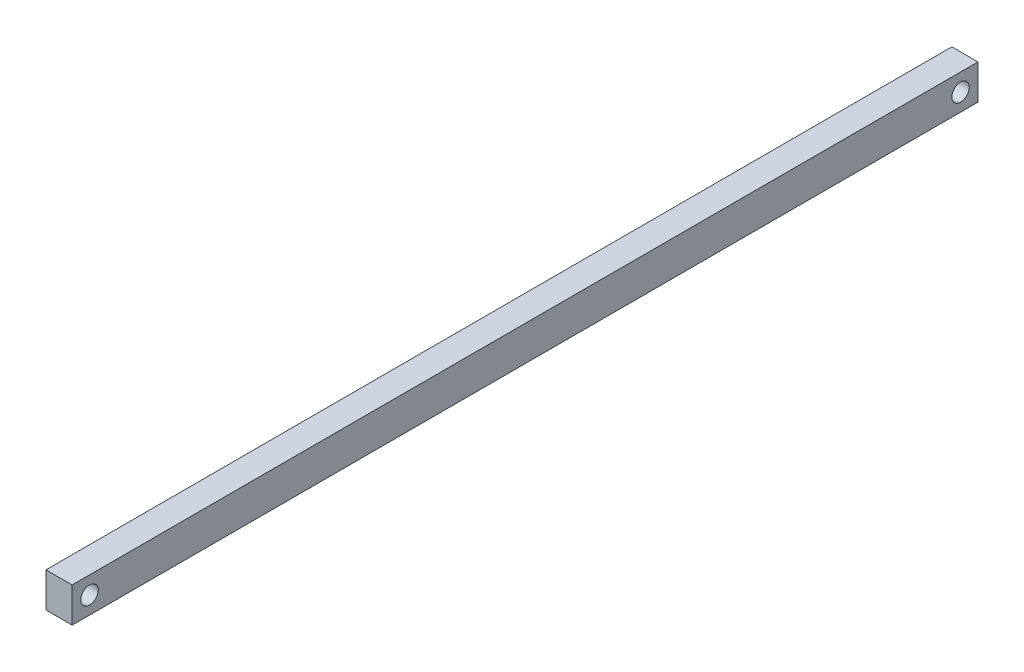
from build123d import *

# Parameters (mm, degrees)
SKETCH1_W               = 19.05
SKETCH1_H               = 25.4
BOSS_EXTRUDE1_DEPTH     = 660.4
CUT_EXTRUDE4_DEPTH      = 661.796755818
CUT_EXTRUDE4_DEPTH_BACK = 661.796755818
SKETCH2_R               = 6.35


with BuildPart() as part:
    # Sketch1 → Boss-Extrude1 (new body)
    with BuildSketch(Plane.XY):
        Rectangle(SKETCH1_W, SKETCH1_H)
    extrude(amount=BOSS_EXTRUDE1_DEPTH)

    # Sketch2 → Cut-Extrude4 (cut, two sides: drawn at the far end of the back side and taken through both)
    with BuildSketch(Plane(origin=(-9.525, 0, 0), x_dir=(0, 0, -1), z_dir=(1, 0, 0)).offset(-CUT_EXTRUDE4_DEPTH_BACK)):
        with Locations((-12.7, 0)):
            Circle(SKETCH2_R)
        with Locations((-647.7, 0)):
            Circle(SKETCH2_R)
    extrude(amount=CUT_EXTRUDE4_DEPTH + CUT_EXTRUDE4_DEPTH_BACK, mode=Mode.SUBTRACT)


solid = part.part
